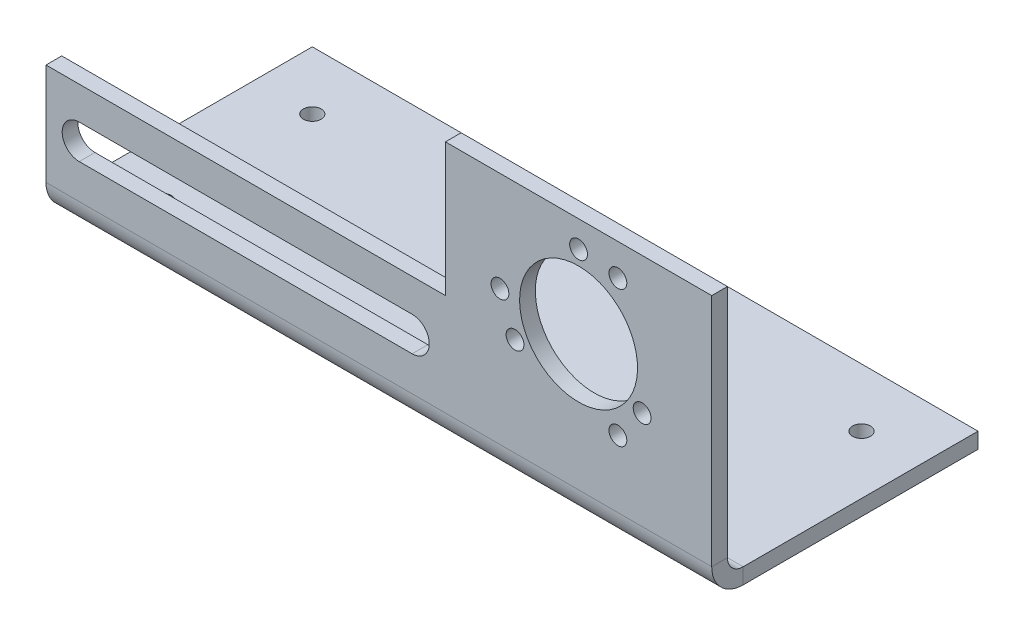
from build123d import *

# Parameters (mm, degrees)
SKETCH1_W                    = 127
SKETCH1_H                    = 50.8
BASE_FLANGE1_DEPTH           = 3
EDGE_FLANGE1_STRIP_W         = 18
EDGE_FLANGE1_STRIP_H         = 3
EDGE_FLANGE1_STRIP_CUT_DEPTH = 127
EDGE_FLANGE1_DEPTH           = 127
UNFOLD1_DEPTH                = 127
UNFOLD1_2_DEPTH              = 127
SKETCH9_R                    = 11.25
SKETCH9_W                    = 76.2
SKETCH9_H                    = 25.4
CUT_EXTRUDE1_DEPTH           = 137.816080926
M3_CLEARANCE_HOLE1_D         = 3.4
M3_CLEARANCE_HOLE1_DEPTH     = 7.62
M3_CLEARANCE_HOLE1_TIP       = 1.021463052
M3_CLEARANCE_HOLE2_D         = 3.4
M3_CLEARANCE_HOLE2_DEPTH     = 7.62
M3_CLEARANCE_HOLE2_TIP       = 1.021463052
FOLD1_START                  = -0.61644
FOLD1_OUTLINE_W              = 127
FOLD1_OUTLINE_H              = 3
FOLD1_DEPTH                  = 46.485023471
FOLD1_START_2                = -3
FOLD1_2_OUTLINE_R            = 1.7
FOLD1_2_OUTLINE_R_2          = 11.25
FOLD1_2_DEPTH                = 0.01644
FOLD1_START_3                = -6
FOLD1_3_OUTLINE_R            = 1.7
FOLD1_3_OUTLINE_R_2          = 11.25
FOLD1_3_DEPTH                = 6
FOLD1_4_DEPTH                = 127


with BuildPart() as part:
    # Base-Flange1: sheet metal written as solids
    # Sketch1 → Base-Flange1 (new body)
    with BuildSketch(Plane(origin=(0, 0, 0), x_dir=(1, 0, 0), z_dir=(0, 1, 0))):
        with Locations((63.5, 25.4)):
            Rectangle(SKETCH1_W, SKETCH1_H)
    extrude(amount=-BASE_FLANGE1_DEPTH)

    # Edge-Flange1: sheet metal written as solids
    # Edge-Flange1 strip (on a plane across the edge) → Edge-Flange1 strip cut (cut)
    with BuildSketch(Plane(origin=(0, 0, 0), x_dir=(0, 0, -1), z_dir=(1, 0, 0))):
        with Locations((-3, -1.5)):
            Rectangle(EDGE_FLANGE1_STRIP_W, EDGE_FLANGE1_STRIP_H)
    extrude(amount=EDGE_FLANGE1_STRIP_CUT_DEPTH, mode=Mode.SUBTRACT)

    # Edge-Flange1 section (on a plane across the edge) → Edge-Flange1 (add)
    with BuildSketch(Plane(origin=(0, 0, 0), x_dir=(0, 0, -1), z_dir=(1, 0, 0))):
        with BuildLine():
            Line((0, 3), (0, 47.8))
            Line((0, 47.8), (3, 47.8))
            Line((3, 47.8), (3, 3))
            ThreePointArc((3, 3), (3.878679656, 0.878679656), (6, 0))
            Line((6, 0), (6, -3))
            ThreePointArc((6, -3), (1.757359313, -1.242640687), (0, 3))
        make_face()
    extrude(amount=EDGE_FLANGE1_DEPTH)

    # Unfold1: read off the stored shape, not the designer's step
    # Unfold1 outline → Unfold1 (cut)
    with BuildSketch(Plane.YZ):
        with BuildLine():
            ThreePointArc((3, 0), (1.447085729, -0.204445042), (0, -0.803847577))
            Line((0, -0.803847577), (0, -6))
            ThreePointArc((0, -6), (0.878679656, -3.878679656), (3, -3))
            Line((3, -3), (47.8, -3))
            Line((47.8, -3), (47.8, 0))
            Line((47.8, 0), (3, 0))
        make_face()
    extrude(amount=UNFOLD1_DEPTH, mode=Mode.SUBTRACT)

    # Unfold1 2 outline → Unfold1 2 (add)
    with BuildSketch(Plane.YZ):
        with BuildLine():
            Line((-3, 45.868583471), (-3, -6))
            ThreePointArc((-3, -6), (-2.196152423, -3), (0, -0.803847577))
            Line((0, -0.803847577), (0, 45.868583471))
            Line((0, 45.868583471), (-3, 45.868583471))
        make_face()
    extrude(amount=UNFOLD1_2_DEPTH)

    # Sketch9 → Cut-Extrude1 (cut, through all)
    with BuildSketch(Plane(origin=(0, 0, 0), x_dir=(1, 0, 0), z_dir=(0, 1, 0))):
        with Locations(Location((101.6, -26.818583471, 0), (0, 0, 270))):
            Circle(SKETCH9_R)
        with Locations((38.1, -33.168583471)):
            Rectangle(SKETCH9_W, SKETCH9_H)
        with BuildLine():
            Line((6.35, -7.679683471), (69.85, -7.679683471))
            ThreePointArc((69.85, -7.679683471), (73.1139, -10.943583471), (69.85, -14.207483471))
            Line((69.85, -14.207483471), (6.35, -14.207483471))
            ThreePointArc((6.35, -14.207483471), (3.0861, -10.943583471), (6.35, -7.679683471))
        make_face()
    extrude(amount=-CUT_EXTRUDE1_DEPTH, mode=Mode.SUBTRACT)

    # M3 Clearance Hole1
    with Locations(Plane(origin=(0, 0, 0), x_dir=(1, 0, 0), z_dir=(0, 1, 0))):
        with Locations((109.1, -13.828202414), (101.6, -40.818583471), (109.1, -39.808964527), (89.475644347, -19.818583471), (86.6, -26.818583471), (113.724355653, -19.818583471)):
            Hole(M3_CLEARANCE_HOLE1_D / 2, depth=M3_CLEARANCE_HOLE1_DEPTH)
            with Locations((0, 0, -(M3_CLEARANCE_HOLE1_DEPTH + M3_CLEARANCE_HOLE1_TIP / 2))):  # 118° drill point
                Cone(0, M3_CLEARANCE_HOLE1_D / 2, M3_CLEARANCE_HOLE1_TIP, mode=Mode.SUBTRACT)

    # M3 Clearance Hole2
    with Locations(Plane(origin=(0, 0, 0), x_dir=(1, 0, 0), z_dir=(0, 1, 0))):
        with Locations((11.1125, 39.6875), (115.8875, 39.6875), (115.8875, 11.1125), (11.1125, 11.1125)):
            Hole(M3_CLEARANCE_HOLE2_D / 2, depth=M3_CLEARANCE_HOLE2_DEPTH)
            with Locations((0, 0, -(M3_CLEARANCE_HOLE2_DEPTH + M3_CLEARANCE_HOLE2_TIP / 2))):  # 118° drill point
                Cone(0, M3_CLEARANCE_HOLE2_D / 2, M3_CLEARANCE_HOLE2_TIP, mode=Mode.SUBTRACT)

    # Fold1: read off the stored shape, not the designer's step
    # Fold1 outline → Fold1 (cut)
    with BuildSketch(Plane.XY.offset(FOLD1_START)):
        with Locations((63.5, -1.5)):
            Rectangle(FOLD1_OUTLINE_W, FOLD1_OUTLINE_H)
    extrude(amount=FOLD1_DEPTH, mode=Mode.SUBTRACT)

    # Fold1 2 outline → Fold1 2 (add)
    with BuildSketch(Plane.XY.offset(FOLD1_START_2)):
        Polygon((0, 22.4), (0, 0), (127, 0), (127, 47.8), (76.2, 47.8), (76.2, 22.4), align=None)
        with BuildLine():
            Line((69.85, 9.6111), (6.35, 9.6111))
            ThreePointArc((6.35, 9.6111), (3.0861, 12.875), (6.35, 16.1389))
            Line((6.35, 16.1389), (69.85, 16.1389))
            ThreePointArc((69.85, 16.1389), (73.1139, 12.875), (69.85, 9.6111))
        make_face(mode=Mode.SUBTRACT)
        with Locations((89.475644347, 21.75)):
            Circle(FOLD1_2_OUTLINE_R, mode=Mode.SUBTRACT)
        with Locations((109.1, 15.759618943)):
            Circle(FOLD1_2_OUTLINE_R, mode=Mode.SUBTRACT)
        with Locations((113.724355653, 21.75)):
            Circle(FOLD1_2_OUTLINE_R, mode=Mode.SUBTRACT)
        with Locations((86.6, 28.75)):
            Circle(FOLD1_2_OUTLINE_R, mode=Mode.SUBTRACT)
        with Locations((101.6, 28.75)):
            Circle(FOLD1_2_OUTLINE_R_2, mode=Mode.SUBTRACT)
        with Locations((101.6, 42.75)):
            Circle(FOLD1_2_OUTLINE_R, mode=Mode.SUBTRACT)
        with Locations((109.1, 41.740381057)):
            Circle(FOLD1_2_OUTLINE_R, mode=Mode.SUBTRACT)
    extrude(amount=FOLD1_2_DEPTH)

    # Fold1 3 outline → Fold1 3 (add)
    with BuildSketch(Plane.XY.offset(FOLD1_START_3)):
        Polygon((0, 22.4), (0, 0), (127, 0), (127, 47.8), (76.2, 47.8), (76.2, 22.4), align=None)
        with BuildLine():
            Line((69.85, 9.6111), (6.35, 9.6111))
            ThreePointArc((6.35, 9.6111), (3.0861, 12.875), (6.35, 16.1389))
            Line((6.35, 16.1389), (69.85, 16.1389))
            ThreePointArc((69.85, 16.1389), (73.1139, 12.875), (69.85, 9.6111))
        make_face(mode=Mode.SUBTRACT)
        with Locations((89.475644347, 21.75)):
            Circle(FOLD1_3_OUTLINE_R, mode=Mode.SUBTRACT)
        with Locations((109.1, 15.759618943)):
            Circle(FOLD1_3_OUTLINE_R, mode=Mode.SUBTRACT)
        with Locations((113.724355653, 21.75)):
            Circle(FOLD1_3_OUTLINE_R, mode=Mode.SUBTRACT)
        with Locations((86.6, 28.75)):
            Circle(FOLD1_3_OUTLINE_R, mode=Mode.SUBTRACT)
        with Locations((101.6, 28.75)):
            Circle(FOLD1_3_OUTLINE_R_2, mode=Mode.SUBTRACT)
        with Locations((101.6, 42.75)):
            Circle(FOLD1_3_OUTLINE_R, mode=Mode.SUBTRACT)
        with Locations((109.1, 41.740381057)):
            Circle(FOLD1_3_OUTLINE_R, mode=Mode.SUBTRACT)
    extrude(amount=FOLD1_3_DEPTH)

    # Fold1 4 outline → Fold1 4 (cut)
    with BuildSketch(Plane.YZ):
        with BuildLine():
            ThreePointArc((-3, -6), (-1.242640687, -1.757359313), (3, 0))
            Line((3, 0), (0, 0))
            Line((0, 0), (0, -0.61644))
            Line((0, -0.61644), (-3, -0.61644))
            Line((-3, -0.61644), (-3, -6))
        make_face()
        with BuildLine():
            ThreePointArc((3, -3), (0.878679656, -3.878679656), (0, -6))
            Line((0, -6), (47.8, -6))
            Line((47.8, -6), (47.8, -3))
            Line((47.8, -3), (3, -3))
        make_face()
    extrude(amount=FOLD1_4_DEPTH, mode=Mode.SUBTRACT)


solid = part.part
